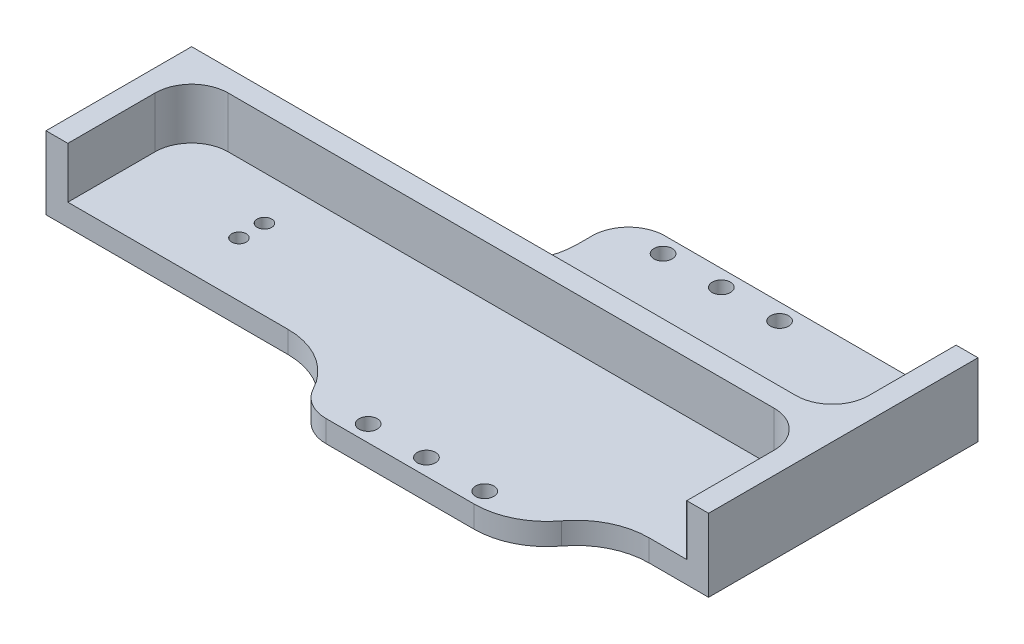
from build123d import *

# Parameters (mm, degrees)
SKETCH1_W           = 30
SKETCH1_H           = 45
SKETCH1_R           = 1.25
LASER_IF_DEPTH      = 3
SKETCH4_R           = 1
VLS_IF_TOP_DEPTH    = 4
SKETCH5_W           = 43
SKETCH5_H           = 20
SKETCH5_R           = 1
SKETCH5_W_2         = 18
SKETCH5_H_2         = 45
BOSS_EXTRUDE1_DEPTH = 3
FILLET1_R           = 10
FILLET2_R           = 5
BOSS_EXTRUDE2_DEPTH = 7
FILLET3_R           = 5
SKETCH7_W           = 18
SKETCH7_H           = 8
CUT_EXTRUDE1_DEPTH  = 83.182723245
FILLET4_R           = 10
FILLET5_R           = 10


with BuildPart() as part:
    # Sketch1 → LASER IF (new body)
    with BuildSketch(Plane(origin=(0, 22.5, 0), x_dir=(1, 0, 0), z_dir=(0, 1, 0))):
        with Locations((39, 16.5)):
            Rectangle(SKETCH1_W, SKETCH1_H)
        with Locations(Location((47, -3.75, 0), (0, 0, 270))):
            Circle(SKETCH1_R, mode=Mode.SUBTRACT)
        with Locations(Location((39, -3.75, 0), (0, 0, 270))):
            Circle(SKETCH1_R, mode=Mode.SUBTRACT)
        with Locations(Location((31, -3.75, 0), (0, 0, 270))):
            Circle(SKETCH1_R, mode=Mode.SUBTRACT)
        with Locations(Location((47, 36.75, 0), (0, 0, 270))):
            Circle(SKETCH1_R, mode=Mode.SUBTRACT)
        with Locations(Location((39, 36.75, 0), (0, 0, 270))):
            Circle(SKETCH1_R, mode=Mode.SUBTRACT)
        with Locations(Location((31, 36.75, 0), (0, 0, 270))):
            Circle(SKETCH1_R, mode=Mode.SUBTRACT)
    extrude(amount=LASER_IF_DEPTH)



with BuildPart() as body_2:
    # Sketch4 → VLS IF TOP (new body)
    with BuildSketch(Plane(origin=(0, 21.5, 0), x_dir=(1, 0, 0), z_dir=(0, 1, 0))):
        with BuildLine():
            Line((3.464101615, 12.5), (2.969229956, 9.071428571))
            ThreePointArc((2.969229956, 9.071428571), (0, 6.5), (-2.969229956, 9.071428571))
            Line((-2.969229956, 9.071428571), (-3.464101615, 12.5))
            ThreePointArc((-3.464101615, 12.5), (0, 16.5), (3.464101615, 12.5))
        make_face()
        with Locations(Location((0, 13, 0), (0, 0, 270))):
            Circle(SKETCH4_R, mode=Mode.SUBTRACT)
        with Locations(Location((0, 9.5, 0), (0, 0, 270))):
            Circle(SKETCH4_R, mode=Mode.SUBTRACT)
    extrude(amount=VLS_IF_TOP_DEPTH)


with BuildPart() as part_1:
    add(part.part)

    add(body_2.part)  # Boss-Extrude1 merges body 2
    # Sketch5 → Boss-Extrude1 (add)
    # profile 1 of 2: a face of its own
    with BuildSketch(Plane(origin=(0, 25.5, 0), x_dir=(1, 0, 0), z_dir=(0, 1, 0))):
        with Locations((2.5, 12)):
            Rectangle(SKETCH5_W, SKETCH5_H)
        with Locations(Location((0, 9.5, 0), (0, 0, 270))):
            Circle(SKETCH5_R, mode=Mode.SUBTRACT)
        with Locations(Location((0, 13, 0), (0, 0, 270))):
            Circle(SKETCH5_R, mode=Mode.SUBTRACT)
    # profile 2 of 2: a face of its own
    with BuildSketch(Plane(origin=(0, 25.5, 0), x_dir=(1, 0, 0), z_dir=(0, 1, 0))):
        with Locations((63, 16.5)):
            Rectangle(SKETCH5_W_2, SKETCH5_H_2)
    extrude(amount=-BOSS_EXTRUDE1_DEPTH)

    # Fillet1
    # the kernel refuses this fillet: 10 mm, written as the material it adds along each edge
    with BuildSketch(Plane(origin=(24, 25.5, -2), x_dir=(-1, 0, 0), z_dir=(0, -1, 0))) as fillet1_piece_1:
        with BuildLine():
            CenterArc((9.797958971, -10), FILLET1_R, 90, 78.463040967)
            Line((0, -8), (-0.195959179, -7.96))
            ThreePointArc((-0.195959179, -7.96), (-0.2, -4), (-0.2, 0))
            Line((-0.2, 0), (0, 0.2))
            Line((0, 0.2), (9.797958971, 0.2))
            Line((9.797958971, 0.2), (9.797958971, 0))
        make_face()
    extrude(amount=3)
    with BuildSketch(Plane(origin=(24, 25.5, -22), x_dir=(-1, 0, 0), z_dir=(0, -1, 0))) as fillet1_piece_2:
        with BuildLine():
            CenterArc((FILLET1_R, FILLET1_R), FILLET1_R, 180, 90)
            Line((0, FILLET1_R), (-FILLET1_R * 0.02, FILLET1_R))
            Line((-FILLET1_R * 0.02, FILLET1_R), (-FILLET1_R * 0.02, -FILLET1_R * 0.02))
            Line((-FILLET1_R * 0.02, -FILLET1_R * 0.02), (FILLET1_R, -FILLET1_R * 0.02))
            Line((FILLET1_R, -FILLET1_R * 0.02), (FILLET1_R, 0))
        make_face()
    extrude(amount=3)

    # Fillet2
    fillet2_edges = [part_1.edges().sort_by_distance(p)[0] for p in [
        (24, 24, -39),
        (24, 24, 6),
    ]]
    fillet(fillet2_edges, radius=FILLET2_R)

    # Sketch6 → Boss-Extrude2 (add)
    with BuildSketch(Plane(origin=(0, 25.5, 0), x_dir=(1, 0, 0), z_dir=(0, 1, 0))):
        Polygon((-16, 2), (-19, 2), (-19, 22), (69, 22), (69, 39), (72, 39), (72, 2), (69, 2), (69, 19), (-16, 19), align=None)
    extrude(amount=BOSS_EXTRUDE2_DEPTH)

    # Fillet3
    fillet3_edges = [part_1.edges().sort_by_distance(p)[0] for p in [
        (-16, 29, -19),
        (69, 29, -19),
        (69, 29, -22),
    ]]
    fillet(fillet3_edges, radius=FILLET3_R)

    # Sketch7 → Cut-Extrude1 (cut, through all)
    with BuildSketch(Plane(origin=(0, 25.5, 0), x_dir=(1, 0, 0), z_dir=(0, 1, 0))):
        with Locations((63, -2)):
            Rectangle(SKETCH7_W, SKETCH7_H)
    extrude(amount=-CUT_EXTRUDE1_DEPTH, mode=Mode.SUBTRACT)

    # Fillet4
    # the kernel refuses this fillet: 10 mm, written as the material it adds along each edge
    with BuildSketch(Plane(origin=(54, 25.5, -2), x_dir=(0, 0, 1), z_dir=(0, -1, 0))) as fillet4_piece_1:
        with BuildLine():
            CenterArc((10, -9.797958971), FILLET4_R, 101.536959033, 78.463040967)
            Line((0, -9.797958971), (-0.2, -9.797958971))
            Line((-0.2, -9.797958971), (-0.2, 0))
            Line((-0.2, 0), (0, 0.2))
            ThreePointArc((0, 0.2), (4, 0.2), (7.96, 0.195959179))
            Line((7.96, 0.195959179), (8, 0))
        make_face()
    extrude(amount=3)

    # Fillet5
    fillet5_edges = [part_1.edges().sort_by_distance(p)[0] for p in [
        (54, 24, 6),
    ]]
    fillet(fillet5_edges, radius=FILLET5_R)


solid = part_1.part
